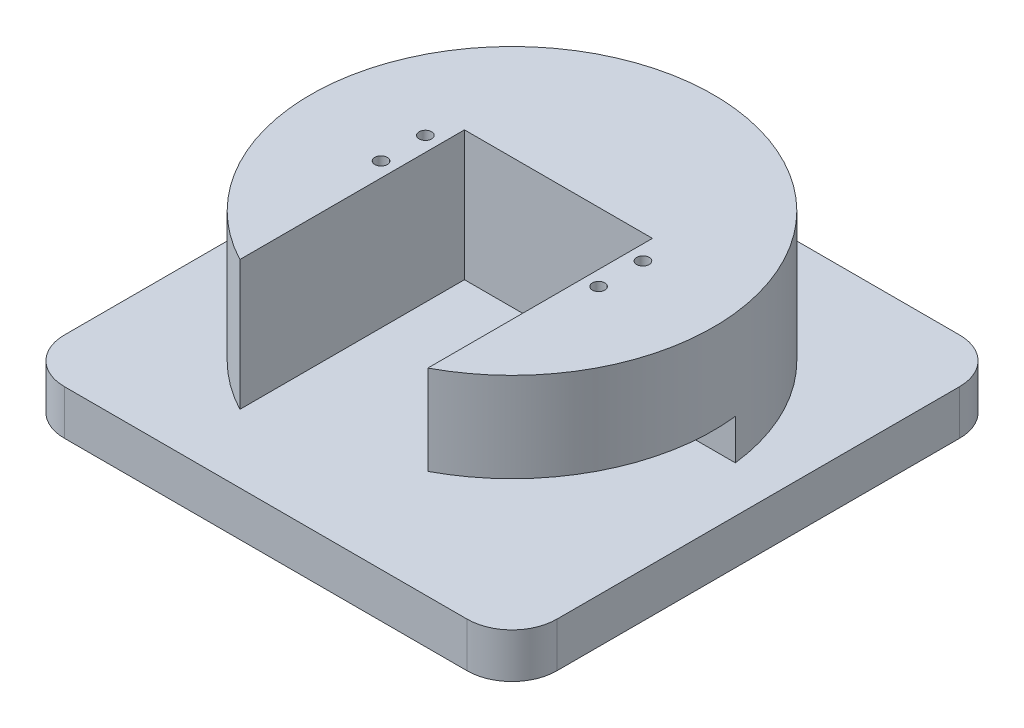
from build123d import *

# Parameters (mm, degrees)
SKETCH1_R           = 45
BOSS_EXTRUDE1_DEPTH = 29
SKETCH1_3_W         = 110
SKETCH1_3_H         = 110
BOSS_EXTRUDE2_DEPTH = 10
SKETCH3_W           = 42
SKETCH3_H           = 55.38
CUT_EXTRUDE2_DEPTH  = 29
SKETCH7_R           = 1.4
CUT_EXTRUDE3_DEPTH  = 8
FILLET1_R           = 10
SKETCH20_W          = 45
SKETCH20_H          = 9
CUT_EXTRUDE4_DEPTH  = 24


with BuildPart() as part:
    # Sketch1 → Boss-Extrude1 (new body)
    with BuildSketch(Plane(origin=(0, 0, 0), x_dir=(1, 0, 0), z_dir=(0, 1, 0))):
        Circle(SKETCH1_R)
    extrude(amount=BOSS_EXTRUDE1_DEPTH)

    # Sketch1<3> → Boss-Extrude2 (add)
    with BuildSketch(Plane(origin=(0, 0, 0), x_dir=(1, 0, 0), z_dir=(0, 1, 0))):
        Rectangle(SKETCH1_3_W, SKETCH1_3_H)
    extrude(amount=-BOSS_EXTRUDE2_DEPTH)

    # Sketch3 → Cut-Extrude2 (cut)
    with BuildSketch(Plane(origin=(0, 29, 0), x_dir=(1, 0, 0), z_dir=(0, 1, 0))):
        with Locations((0, -17.310647556)):
            Rectangle(SKETCH3_W, SKETCH3_H)
    extrude(amount=-CUT_EXTRUDE2_DEPTH, mode=Mode.SUBTRACT)

    # Sketch7 → Cut-Extrude3 (cut)
    with BuildSketch(Plane(origin=(0, 29, 0), x_dir=(1, 0, 0), z_dir=(0, 1, 0))):
        with Locations((-24.3, -4.95)):
            Circle(SKETCH7_R)
        with Locations((-24.3, 4.95)):
            Circle(SKETCH7_R)
        with Locations((24.3, -4.95)):
            Circle(SKETCH7_R)
        with Locations((24.3, 4.95)):
            Circle(SKETCH7_R)
    extrude(amount=-CUT_EXTRUDE3_DEPTH, mode=Mode.SUBTRACT)

    # Fillet1
    fillet1_edges = [part.edges().sort_by_distance(p)[0] for p in [
        (-55, -5, -55),
        (55, -5, -55),
        (55, -5, 55),
        (-55, -5, 55),
    ]]
    fillet(fillet1_edges, radius=FILLET1_R)

    # Sketch20 → Cut-Extrude4 (cut)
    with BuildSketch(Plane.ZY.offset(-21)):
        with Locations((17.299497484, 4.5)):
            Rectangle(SKETCH20_W, SKETCH20_H)
    extrude(amount=-CUT_EXTRUDE4_DEPTH, mode=Mode.SUBTRACT)


solid = part.part
